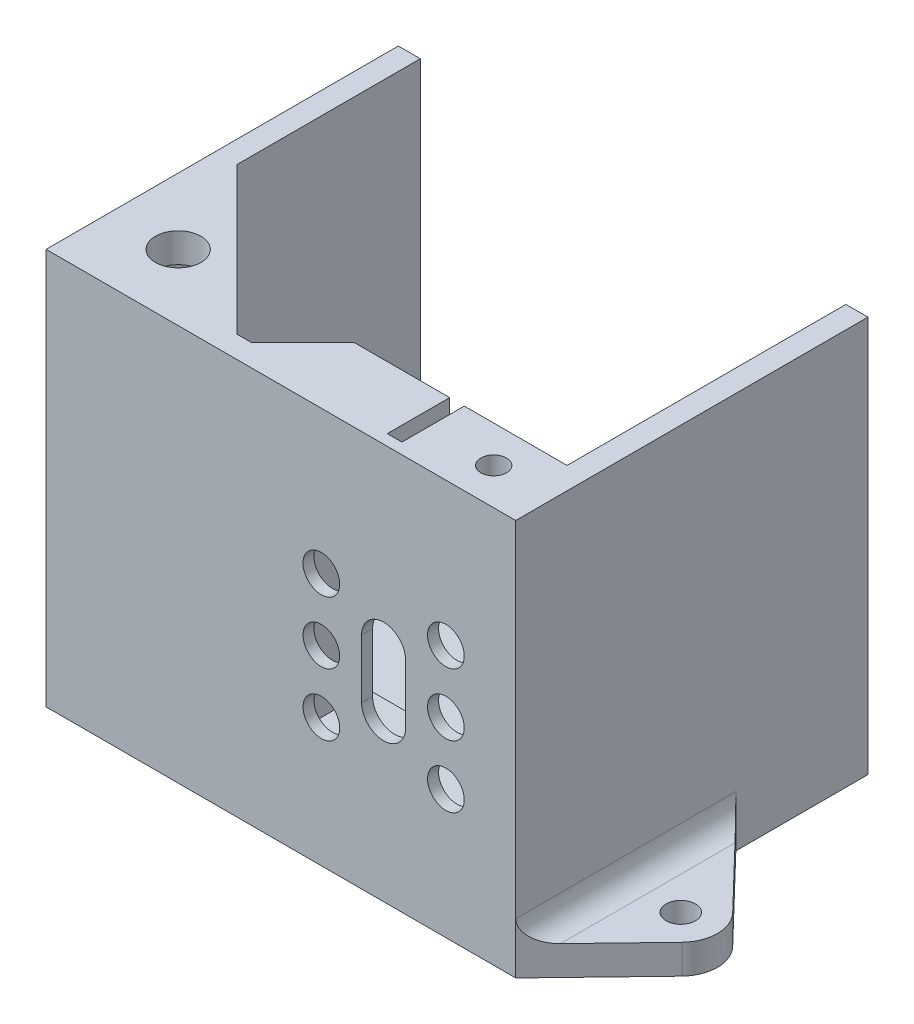
from build123d import *

# Parameters (mm, degrees)
SKETCH1_W           = 64
SKETCH1_H           = 48
BOSS_EXTRUDE1_DEPTH = 4
CUT_EXTRUDE1_DEPTH  = 2.4
CUT_EXTRUDE2_DEPTH  = 2.4
BOSS_EXTRUDE3_DEPTH = 50
BOSS_EXTRUDE4_DEPTH = 50
CUT_EXTRUDE4_DEPTH  = 9.5
SKETCH13_W          = 36.946258726
SKETCH13_H          = 1
CUT_EXTRUDE6_DEPTH  = 32
SKETCH15_R          = 3.1
BOSS_EXTRUDE5_DEPTH = 4
CUT_EXTRUDE7_DEPTH  = 7
SKETCH18_W          = 5.8
SKETCH18_H          = 2.6
CUT_EXTRUDE8_DEPTH  = 5
SKETCH19_R          = 1.75
BOSS_EXTRUDE8_DEPTH = 4.4
FILLET1_R           = 1.5
SKETCH20_R          = 2
BOSS_EXTRUDE9_DEPTH = 4
FILLET2_R           = 3
SKETCH22_R          = 1.75
CUT_EXTRUDE9_DEPTH  = 2
SKETCH23_R          = 2.5
CUT_EXTRUDE10_DEPTH = 3


with BuildPart() as part:
    # Sketch1 → Boss-Extrude1 (new body)
    with BuildSketch(Plane(origin=(0, 0, 0), x_dir=(1, 0, 0), z_dir=(0, 1, 0))):
        Rectangle(SKETCH1_W, SKETCH1_H)
    extrude(amount=BOSS_EXTRUDE1_DEPTH)

    # Sketch2 → Cut-Extrude1 (cut)
    with BuildSketch(Plane.XZ):
        Polygon((-20.651368439, -16), (-22.325684219, -13.1), (-25.674315781, -13.1), (-27.348631561, -16), (-25.674315781, -18.9), (-22.325684219, -18.9), align=None)
    extrude(amount=-CUT_EXTRUDE1_DEPTH, mode=Mode.SUBTRACT)

    # Sketch4 → Cut-Extrude2 (cut)
    with BuildSketch(Plane.XZ):
        Polygon((9.348631561, 10), (7.674315781, 12.9), (4.325684219, 12.9), (2.651368439, 10), (4.325684219, 7.1), (7.674315781, 7.1), align=None)
    extrude(amount=-CUT_EXTRUDE2_DEPTH, mode=Mode.SUBTRACT)

    # Sketch6 → Boss-Extrude3 (add)
    with BuildSketch(Plane(origin=(0, 4, 0), x_dir=(1, 0, 0), z_dir=(0, 1, 0))):
        Polygon((-29, -21), (-29, 21), (-29, 24), (-32, 24), (-32, -24), (32, -24), (32, 24), (29, 24), (29, 21), (29, -21), align=None)
    extrude(amount=BOSS_EXTRUDE3_DEPTH)

    # Sketch9 → Boss-Extrude4 (add)
    with BuildSketch(Plane(origin=(0, 4, 0), x_dir=(1, 0, 0), z_dir=(0, 1, 0))):
        Polygon((29, -13), (1, -13), (-7, -21), (29, -21), align=None)
    extrude(amount=BOSS_EXTRUDE4_DEPTH)

    # Sketch10 → Cut-Extrude4 (cut)
    with BuildSketch(Plane(origin=(0, 0, 13), x_dir=(-1, 0, 0), z_dir=(0, 0, -1))):
        Polygon((-14.998616503, 39), (-27, 39), (-27, 13), (-1, 13), (-1, 39), (-13.001383497, 39), (-13.001383497, 54), (-14.998616503, 54), align=None)
    extrude(amount=-CUT_EXTRUDE4_DEPTH, mode=Mode.SUBTRACT)

    # Sketch13 → Cut-Extrude6 (cut)
    with BuildSketch(Plane(origin=(0, 54, 0), x_dir=(1, 0, 0), z_dir=(0, 1, 0))):
        with Locations((10.526870637, -13.5)):
            Rectangle(SKETCH13_W, SKETCH13_H)
    extrude(amount=-CUT_EXTRUDE6_DEPTH, mode=Mode.SUBTRACT)

    # Sketch15 → Boss-Extrude5 (add)
    with BuildSketch(Plane(origin=(0, 54, 0), x_dir=(1, 0, 0), z_dir=(0, 1, 0))):
        Polygon((-29, -1), (-9, -21), (-29, -21), align=None)
        with Locations((-23, -15)):
            Circle(SKETCH15_R, mode=Mode.SUBTRACT)
    extrude(amount=-BOSS_EXTRUDE5_DEPTH)

    # Sketch17 → Cut-Extrude7 (cut)
    with BuildSketch(Plane(origin=(0, 54, 0), x_dir=(1, 0, 0), z_dir=(0, 1, 0))):
        Polygon((24, -15.651368439), (21.1, -17.325684219), (21.1, -20.674315781), (24, -22.348631561), (26.9, -20.674315781), (26.9, -17.325684219), align=None)
    extrude(amount=-CUT_EXTRUDE7_DEPTH, mode=Mode.SUBTRACT)

    # Sketch18 → Cut-Extrude8 (cut)
    with BuildSketch(Plane(origin=(0, 0, 14), x_dir=(-1, 0, 0), z_dir=(0, 0, -1))):
        with Locations((-24, 48.3)):
            Rectangle(SKETCH18_W, SKETCH18_H)
    extrude(amount=-CUT_EXTRUDE8_DEPTH, mode=Mode.SUBTRACT)

    # Sketch19 → Boss-Extrude8 (add)
    with BuildSketch(Plane(origin=(0, 54, 0), x_dir=(1, 0, 0), z_dir=(0, 1, 0))):
        Polygon((26.9, -17.325684219), (24, -15.651368439), (21.1, -17.325684219), (21.1, -20.674315781), (24, -22.348631561), (26.9, -20.674315781), align=None)
        with Locations((24, -19)):
            Circle(SKETCH19_R, mode=Mode.SUBTRACT)
    extrude(amount=-BOSS_EXTRUDE8_DEPTH)

    # Fillet1
    fillet1_edges = [part.edges().sort_by_distance(p)[0] for p in [
        (-29, 50, 11),
        (-19, 50, 21),
    ]]
    fillet(fillet1_edges, radius=FILLET1_R)

    # Sketch20 → Boss-Extrude9 (add)
    # profile 1 of 2: a face of its own
    with BuildSketch(Plane.XZ):
        with BuildLine():
            Line((43.102082828, 12.467708073), (32.000000003, 23.999999995))
            Line((32.000000003, 23.999999995), (32, -6.000000006))
            Line((32, -6.000000006), (43.102082822, 5.532291908))
            ThreePointArc((43.102082822, 5.532291908), (44.500000003, 8.99999999), (43.102082828, 12.467708073))
        make_face()
        with Locations((39.500000002, 8.999999994)):
            Circle(SKETCH20_R, mode=Mode.SUBTRACT)
    # profile 2 of 2: a face of its own
    with BuildSketch(Plane.XZ):
        with BuildLine():
            Line((-32, -24), (-32, 2.000000002))
            Line((-32, 2.000000002), (-42.978939192, -7.408763151))
            ThreePointArc((-42.978939192, -7.408763151), (-44.499999999, -10.999999999), (-42.978939192, -14.591236846))
            Line((-42.978939192, -14.591236846), (-32, -24))
        make_face()
        with Locations((-39.499999999, -10.999999999)):
            Circle(SKETCH20_R, mode=Mode.SUBTRACT)
    extrude(amount=-BOSS_EXTRUDE9_DEPTH)

    # Fillet2
    fillet2_edges = [part.edges().sort_by_distance(p)[0] for p in [
        (-32, 4, -10.999999999),
        (32.000000002, 4, 8.999999995),
    ]]
    fillet(fillet2_edges, radius=FILLET2_R)

    # Sketch22 → Cut-Extrude9 (cut)
    with BuildSketch(Plane.XZ.offset(-2.4)):
        with Locations((-24, -16)):
            Circle(SKETCH22_R)
        with Locations((6, 10)):
            Circle(SKETCH22_R)
    extrude(amount=-CUT_EXTRUDE9_DEPTH, mode=Mode.SUBTRACT)

    # Sketch23 → Cut-Extrude10 (cut)
    with BuildSketch(Plane(origin=(0, 0, 22.5), x_dir=(-1, 0, 0), z_dir=(0, 0, -1))):
        with Locations((-22.485281374, 34.485281374)):
            Circle(SKETCH23_R)
        with Locations((-5.514718626, 34.485281374)):
            Circle(SKETCH23_R)
        with Locations((-5.514718626, 17.514718626)):
            Circle(SKETCH23_R)
        with Locations((-22.485281374, 17.514718626)):
            Circle(SKETCH23_R)
        with Locations((-22.485281374, 26)):
            Circle(SKETCH23_R)
        with Locations((-5.514718626, 26)):
            Circle(SKETCH23_R)
        with BuildLine():
            Line((-11, 30), (-11, 22))
            ThreePointArc((-11, 22), (-14, 19), (-17, 22))
            Line((-17, 22), (-17, 30))
            ThreePointArc((-17, 30), (-14, 33), (-11, 30))
        make_face()
    extrude(amount=-CUT_EXTRUDE10_DEPTH, mode=Mode.SUBTRACT)


solid = part.part
